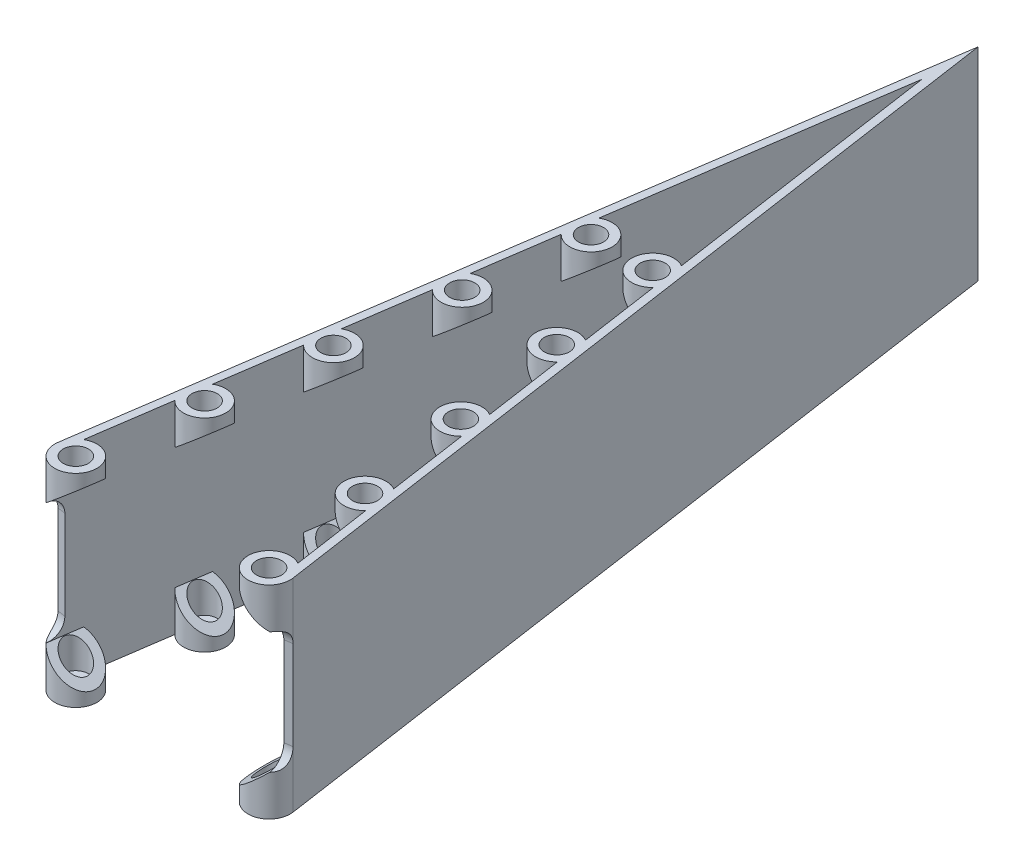
from build123d import *

# Parameters (mm, degrees)
BOSS_EXTRUDE1_DEPTH            = 25
SKETCH2_R                      = 2.6
SKETCH2_R_2                    = 1.55
BOSS_EXTRUDE3_DEPTH            = 5
CUT_EXTRUDE1_REACH             = 107.119
CUT_EXTRUDE1_DIRECTION_2_DEPTH = 106.119492302
CUT_EXTRUDE2_REACH             = 107.119
CUT_EXTRUDE2_DIRECTION_2_DEPTH = 106.119492302
FILLET1_R                      = 2
SKETCH6_R                      = 1.55
BOSS_EXTRUDE4_DEPTH            = 1


with BuildPart() as part:
    # Sketch1 → Boss-Extrude1 (new body)
    with BuildSketch(Plane(origin=(0, 0, 0), x_dir=(1, 0, 0), z_dir=(0, 1, 0))):
        Polygon((-13.5, 0), (0, 92.188031325), (13.5, 0), (14.489447114, 0.144894471), (0, 99.089605913), (-14.489447114, 0.144894471), align=None)
    extrude(amount=BOSS_EXTRUDE1_DEPTH)

    # Sketch2 → Boss-Extrude3 (add)
    # profile 1 of 10: a face of its own
    with BuildSketch(Plane(origin=(0, 0, 0), x_dir=(1, 0, 0), z_dir=(0, 1, 0))):
        with Locations((11.916884617, -0.231831154)):
            Circle(SKETCH2_R)
        with Locations(Location((11.916884617, -0.231831154, 0), (0, 0, 270))):
            Circle(SKETCH2_R_2, mode=Mode.SUBTRACT)
    # profile 2 of 10: a face of its own
    with BuildSketch(Plane(origin=(0, 0, 0), x_dir=(1, 0, 0), z_dir=(0, 1, 0))):
        with Locations((9.888362021, 13.620428448)):
            Circle(SKETCH2_R)
        with Locations(Location((9.888362021, 13.620428448, 0), (0, 0, 270))):
            Circle(SKETCH2_R_2, mode=Mode.SUBTRACT)
    # profile 3 of 10: a face of its own
    with BuildSketch(Plane(origin=(0, 0, 0), x_dir=(1, 0, 0), z_dir=(0, 1, 0))):
        with Locations((7.859839425, 27.47268805)):
            Circle(SKETCH2_R)
        with Locations(Location((7.859839425, 27.47268805, 0), (0, 0, 270))):
            Circle(SKETCH2_R_2, mode=Mode.SUBTRACT)
    # profile 4 of 10: a face of its own
    with BuildSketch(Plane(origin=(0, 0, 0), x_dir=(1, 0, 0), z_dir=(0, 1, 0))):
        with Locations((5.831316829, 41.324947652)):
            Circle(SKETCH2_R)
        with Locations(Location((5.831316829, 41.324947652, 0), (0, 0, 270))):
            Circle(SKETCH2_R_2, mode=Mode.SUBTRACT)
    # profile 5 of 10: a face of its own
    with BuildSketch(Plane(origin=(0, 0, 0), x_dir=(1, 0, 0), z_dir=(0, 1, 0))):
        with Locations((3.802794233, 55.177207254)):
            Circle(SKETCH2_R)
        with Locations(Location((3.802794233, 55.177207254, 0), (0, 0, 270))):
            Circle(SKETCH2_R_2, mode=Mode.SUBTRACT)
    # profile 6 of 10: a face of its own
    with BuildSketch(Plane(origin=(0, 0, 0), x_dir=(1, 0, 0), z_dir=(0, 1, 0))):
        with Locations((-11.916884617, -0.231831154)):
            Circle(SKETCH2_R)
        with Locations(Location((-11.916884617, -0.231831154, 0), (0, 0, 90))):
            Circle(SKETCH2_R_2, mode=Mode.SUBTRACT)
    # profile 7 of 10: a face of its own
    with BuildSketch(Plane(origin=(0, 0, 0), x_dir=(1, 0, 0), z_dir=(0, 1, 0))):
        with Locations((-9.888362021, 13.620428448)):
            Circle(SKETCH2_R)
        with Locations(Location((-9.888362021, 13.620428448, 0), (0, 0, 90))):
            Circle(SKETCH2_R_2, mode=Mode.SUBTRACT)
    # profile 8 of 10: a face of its own
    with BuildSketch(Plane(origin=(0, 0, 0), x_dir=(1, 0, 0), z_dir=(0, 1, 0))):
        with Locations((-7.859839425, 27.47268805)):
            Circle(SKETCH2_R)
        with Locations(Location((-7.859839425, 27.47268805, 0), (0, 0, 90))):
            Circle(SKETCH2_R_2, mode=Mode.SUBTRACT)
    # profile 9 of 10: a face of its own
    with BuildSketch(Plane(origin=(0, 0, 0), x_dir=(1, 0, 0), z_dir=(0, 1, 0))):
        with Locations((-5.831316829, 41.324947652)):
            Circle(SKETCH2_R)
        with Locations(Location((-5.831316829, 41.324947652, 0), (0, 0, 90))):
            Circle(SKETCH2_R_2, mode=Mode.SUBTRACT)
    # profile 10 of 10: a face of its own
    with BuildSketch(Plane(origin=(0, 0, 0), x_dir=(1, 0, 0), z_dir=(0, 1, 0))):
        with Locations((-3.802794233, 55.177207254)):
            Circle(SKETCH2_R)
        with Locations(Location((-3.802794233, 55.177207254, 0), (0, 0, 90))):
            Circle(SKETCH2_R_2, mode=Mode.SUBTRACT)
    boss_extrude3 = extrude(amount=BOSS_EXTRUDE3_DEPTH)

    # Cut-Extrude1: up to this face of the body (flat: up to its plane)
    cut_extrude1_end = Plane(part.part.faces().sort_by_distance((-6.65824674, 12.912249129, -46.7205751))[0])
    # Sketch4 → Cut-Extrude1 (cut, up to the picked face)
    with BuildSketch(Plane(origin=(0.283424505, 0, 1.935433121), x_dir=(0.9894471144188783, 0, -0.14489447114419254), z_dir=(0.14489447114419252, 0, 0.9894471144188782)), mode=Mode.PRIVATE) as cut_extrude1_sk1:
        Polygon((13.357536045, 5), (9.157536045, 5), (9.157536045, 1.475781549), align=None)
    cut_extrude1_tool1 = split(extrude(cut_extrude1_sk1.sketch, amount=-CUT_EXTRUDE1_REACH, mode=Mode.PRIVATE), bisect_by=cut_extrude1_end, keep=Keep.BOTH, mode=Mode.PRIVATE)
    cut_extrude1 = cut_extrude1_tool1.solids().sort_by(Axis((10.729548, 3.825261, 0.405705), (-0.14489447114419252, 0, -0.9894471144188782)))[0]
    add(cut_extrude1, mode=Mode.SUBTRACT)

    # Sketch4 → Cut-Extrude1 direction 2 (cut)
    with BuildSketch(Plane(origin=(0.283424505, 0, 1.935433121), x_dir=(0.9894471144188783, 0, -0.14489447114419254), z_dir=(0.14489447114419252, 0, 0.9894471144188782))):
        Polygon((13.357536045, 5), (9.157536045, 5), (9.157536045, 1.475781549), align=None)
    cut_extrude1_direction_2 = extrude(amount=CUT_EXTRUDE1_DIRECTION_2_DEPTH, mode=Mode.SUBTRACT)

    # Cut-Extrude2: up to this face of the body (flat: up to its plane)
    cut_extrude2_end = Plane(part.part.faces().sort_by_distance((6.65824674, 12.912249129, -46.7205751))[0])
    # Sketch5 → Cut-Extrude2 (cut, up to the picked face)
    with BuildSketch(Plane(origin=(-0.283424505, 0, 1.935433121), x_dir=(0.9894471144188784, 0, 0.14489447114419146), z_dir=(-0.14489447114419146, 0, 0.9894471144188784)), mode=Mode.PRIVATE) as cut_extrude2_sk1:
        Polygon((-9.157536045, 5), (-9.157536045, 1.475781549), (-13.357536045, 5), align=None)
    cut_extrude2_tool1 = split(extrude(cut_extrude2_sk1.sketch, amount=-CUT_EXTRUDE2_REACH, mode=Mode.PRIVATE), bisect_by=cut_extrude2_end, keep=Keep.BOTH, mode=Mode.PRIVATE)
    cut_extrude2 = cut_extrude2_tool1.solids().sort_by(Axis((-10.729548, 3.825261, 0.405705), (0.14489447114419146, 0, -0.9894471144188784)))[0]
    add(cut_extrude2, mode=Mode.SUBTRACT)

    # Sketch5 → Cut-Extrude2 direction 2 (cut)
    with BuildSketch(Plane(origin=(-0.283424505, 0, 1.935433121), x_dir=(0.9894471144188784, 0, 0.14489447114419146), z_dir=(-0.14489447114419146, 0, 0.9894471144188784))):
        Polygon((-9.157536045, 5), (-9.157536045, 1.475781549), (-13.357536045, 5), align=None)
    cut_extrude2_direction_2 = extrude(amount=CUT_EXTRUDE2_DIRECTION_2_DEPTH, mode=Mode.SUBTRACT)

    # Mirror2: Boss-Extrude3, Cut-Extrude1, Cut-Extrude1 direction 2, Cut-Extrude2, Cut-Extrude2 direction 2 across plane
    add(boss_extrude3.mirror(Plane.ZX.offset(12.5)))
    add(cut_extrude1.mirror(Plane.ZX.offset(12.5)), mode=Mode.SUBTRACT)
    add(cut_extrude1_direction_2.mirror(Plane.ZX.offset(12.5)), mode=Mode.SUBTRACT)
    add(cut_extrude2.mirror(Plane.ZX.offset(12.5)), mode=Mode.SUBTRACT)
    add(cut_extrude2_direction_2.mirror(Plane.ZX.offset(12.5)), mode=Mode.SUBTRACT)

    # Fillet1
    # the kernel refuses this fillet: 2 mm, written as the material it adds along each edge
    with BuildSketch(Plane(origin=(13.5, 5, 0), x_dir=(0, 1, 0), z_dir=(0.9894471144188783, 0, -0.1448944711441925))) as fillet1_piece_1_section:
        with BuildLine():
            CenterArc((FILLET1_R, FILLET1_R), FILLET1_R, 180, 90)
            Line((0, FILLET1_R), (0, 0))
            Line((0, 0), (FILLET1_R, 0))
        make_face()
    fillet1_piece_1 = extrude(amount=6, mode=Mode.PRIVATE)
    fillet1_piece_1 = fillet1_piece_1 & Plane(origin=(11.916884617, 5, 0.231831154), x_dir=(1, 0, 0), z_dir=(0, -1, 0)) * Cylinder(2.6, 20, mode=Mode.PRIVATE)
    add(fillet1_piece_1)
    with BuildSketch(Plane(origin=(13.5, 20, 0), x_dir=(0, -1, 0), z_dir=(0.9894471144188783, 0, -0.1448944711441925))) as fillet1_piece_2_section:
        with BuildLine():
            CenterArc((FILLET1_R, -FILLET1_R), FILLET1_R, 90, 90)
            Line((0, -FILLET1_R), (0, 0))
            Line((0, 0), (FILLET1_R, 0))
        make_face()
    fillet1_piece_2 = extrude(amount=6, mode=Mode.PRIVATE)
    fillet1_piece_2 = fillet1_piece_2 & Plane(origin=(11.916884617, 20, 0.231831154), x_dir=(1, 0, 0), z_dir=(0, 1, 0)) * Cylinder(2.6, 20, mode=Mode.PRIVATE)
    add(fillet1_piece_2)
    with BuildSketch(Plane(origin=(-19.436682687, 20, -0.869366827), x_dir=(0, -1, 0), z_dir=(0.9894471144188784, 0, 0.1448944711441914))) as fillet1_piece_3_section:
        with BuildLine():
            CenterArc((FILLET1_R, -FILLET1_R), FILLET1_R, 90, 90)
            Line((0, -FILLET1_R), (0, 0))
            Line((0, 0), (FILLET1_R, 0))
        make_face()
    fillet1_piece_3 = extrude(amount=6, mode=Mode.PRIVATE)
    fillet1_piece_3 = fillet1_piece_3 & Plane(origin=(-11.916884617, 20, 0.231831154), x_dir=(1, 0, 0), z_dir=(0, 1, 0)) * Cylinder(2.6, 21, mode=Mode.PRIVATE)
    add(fillet1_piece_3)
    with BuildSketch(Plane(origin=(-19.436682687, 5, -0.869366827), x_dir=(-0.1448944711441914, 0, 0.9894471144188784), z_dir=(0.9894471144188784, 0, 0.1448944711441914))) as fillet1_piece_4_section:
        with BuildLine():
            CenterArc((FILLET1_R, -FILLET1_R), FILLET1_R, 90, 90)
            Line((0, -FILLET1_R), (0, 0))
            Line((0, 0), (FILLET1_R, 0))
        make_face()
    fillet1_piece_4 = extrude(amount=6, mode=Mode.PRIVATE)
    fillet1_piece_4 = fillet1_piece_4 & Plane(origin=(-11.916884617, 5, 0.231831154), x_dir=(1, 0, 0), z_dir=(0, -1, 0)) * Cylinder(2.6, 21, mode=Mode.PRIVATE)
    add(fillet1_piece_4)

    # Sketch6 → Boss-Extrude4 (add)
    with BuildSketch(Plane.XZ):
        with Locations(Location((3.802794233, -55.177207254, 0), (0, 0, 270))):
            Circle(SKETCH6_R)
        with Locations(Location((-3.802794233, -55.177207254, 0), (0, 0, 270))):
            Circle(SKETCH6_R)
        with Locations(Location((-5.831316829, -41.324947652, 0), (0, 0, 270))):
            Circle(SKETCH6_R)
        with Locations(Location((5.831316829, -41.324947652, 0), (0, 0, 270))):
            Circle(SKETCH6_R)
        with Locations(Location((7.859839425, -27.47268805, 0), (0, 0, 270))):
            Circle(SKETCH6_R)
        with Locations(Location((-7.859839425, -27.47268805, 0), (0, 0, 270))):
            Circle(SKETCH6_R)
        with Locations(Location((-9.888362021, -13.620428448, 0), (0, 0, 270))):
            Circle(SKETCH6_R)
        with Locations(Location((9.888362021, -13.620428448, 0), (0, 0, 270))):
            Circle(SKETCH6_R)
        with Locations(Location((11.916884617, 0.231831154, 0), (0, 0, 270))):
            Circle(SKETCH6_R)
        with Locations(Location((-11.916884617, 0.231831154, 0), (0, 0, 270))):
            Circle(SKETCH6_R)
    extrude(amount=-BOSS_EXTRUDE4_DEPTH)


solid = part.part
